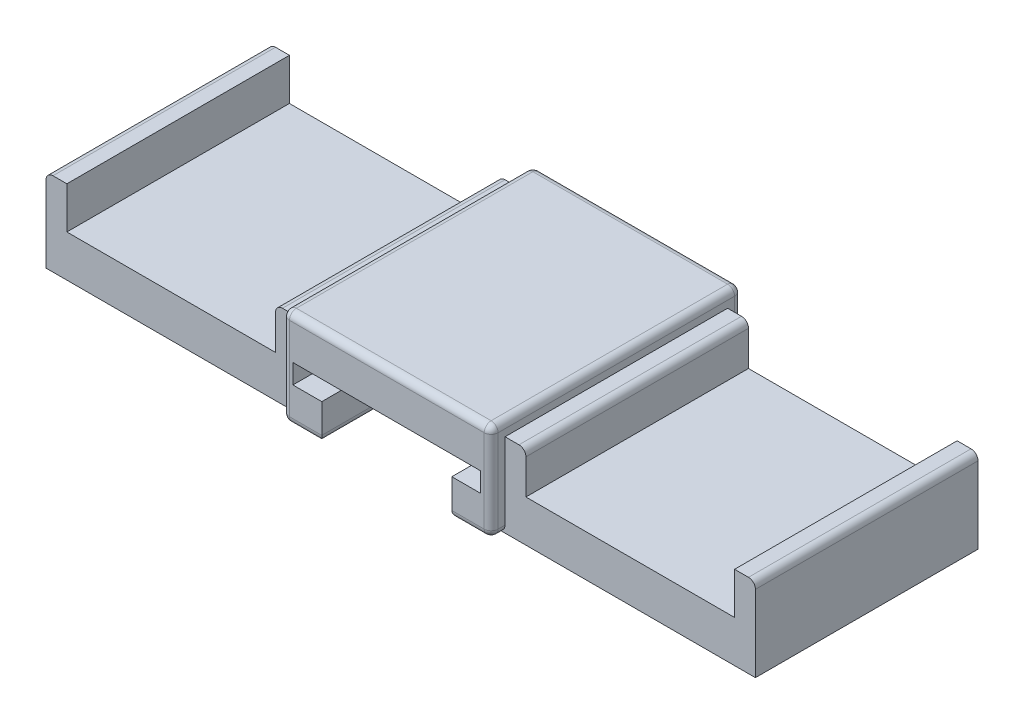
from build123d import *

# Parameters (mm, degrees)
SKETCH1_W           = 15
SKETCH1_H           = 18
BOSS_EXTRUDE1_DEPTH = 7
CUT_EXTRUDE1_DEPTH  = 14.2
SKETCH8_W           = 0.5
SKETCH8_H           = 2.6
CUT_EXTRUDE4_DEPTH  = 10
SKETCH9_W           = 16
SKETCH9_H           = 6
BOSS_EXTRUDE2_DEPTH = 18
SKETCH13_W          = 16
SKETCH13_H          = 6
BOSS_EXTRUDE3_DEPTH = 18
SKETCH14_W          = 15
SKETCH14_H          = 3
CUT_EXTRUDE5_DEPTH  = 32.55
FILLET1_R           = 0.5


with BuildPart() as part:
    # Sketch1 → Boss-Extrude1 (new body)
    with BuildSketch(Plane(origin=(0, 0, 0), x_dir=(1, 0, 0), z_dir=(0, 1, 0))):
        Rectangle(SKETCH1_W, SKETCH1_H)
    extrude(amount=BOSS_EXTRUDE1_DEPTH)

    # Sketch2 → Cut-Extrude1 (cut)
    with BuildSketch(Plane.XY.offset(9)):
        Polygon((-4.675, 2.6), (-4.675, 0), (-1.1, 0), (-1.1, 2.6), (-0.6, 2.6), (-0.6, 0), (0.6, 0), (0.6, 2.6), (1.1, 2.6), (1.1, 0), (4.675, 0), (4.675, 2.6), (6.75, 2.6), (6.75, 4), (-6.75, 4), (-6.75, 2.6), align=None)
    extrude(amount=-CUT_EXTRUDE1_DEPTH, mode=Mode.SUBTRACT)

    # Sketch8 → Cut-Extrude4 (cut)
    with BuildSketch(Plane.XY.offset(9)):
        with Locations((-0.85, 1.3)):
            Rectangle(SKETCH8_W, SKETCH8_H)
        with Locations((0.85, 1.3)):
            Rectangle(SKETCH8_W, SKETCH8_H)
    extrude(amount=-CUT_EXTRUDE4_DEPTH, mode=Mode.SUBTRACT)

    # Sketch9 → Boss-Extrude2 (add)
    with BuildSketch(Plane.ZY.offset(7.5)):
        with Locations((0, 3)):
            Rectangle(SKETCH9_W, SKETCH9_H)
    extrude(amount=BOSS_EXTRUDE2_DEPTH)

    # Sketch13 → Boss-Extrude3 (add)
    with BuildSketch(Plane(origin=(7.5, 0, 0), x_dir=(0, 0, -1), z_dir=(1, 0, 0))):
        with Locations((0, 3)):
            Rectangle(SKETCH13_W, SKETCH13_H)
    extrude(amount=BOSS_EXTRUDE3_DEPTH)

    # Sketch14 → Cut-Extrude5 (cut)
    with BuildSketch(Plane.XY.offset(9)):
        with Locations((16.5, 4.5)):
            Rectangle(SKETCH14_W, SKETCH14_H)
        with Locations((-16.5, 4.5)):
            Rectangle(SKETCH14_W, SKETCH14_H)
    extrude(amount=-CUT_EXTRUDE5_DEPTH, mode=Mode.SUBTRACT)

    # Fillet1
    fillet1_edges = [part.edges().sort_by_distance(p)[0] for p in [
        (0, 0, -9),
        (7.5, 0, -8.5),
        (-7.5, 0, -8.5),
        (-7.5, 0, 8.5),
        (7.5, 0, 8.5),
        (7.5, 7, 0),
        (25.5, 6, 0),
        (-25.5, 6, 0),
        (-7.5, 7, 0),
        (-7.5, 3.5, 9),
        (7.5, 3.5, 9),
        (6.0875, 0, 9),
        (4.675, 0, 1.9),
        (-4.675, 0, 1.9),
        (-6.0875, 0, 9),
        (0, 7, 9),
        (0, 7, -9),
        (7.5, 3.5, -9),
        (-7.5, 3.5, -9),
        (-9, 6, 0),
        (9, 6, 0),
    ]]
    fillet(fillet1_edges, radius=FILLET1_R)


solid = part.part
